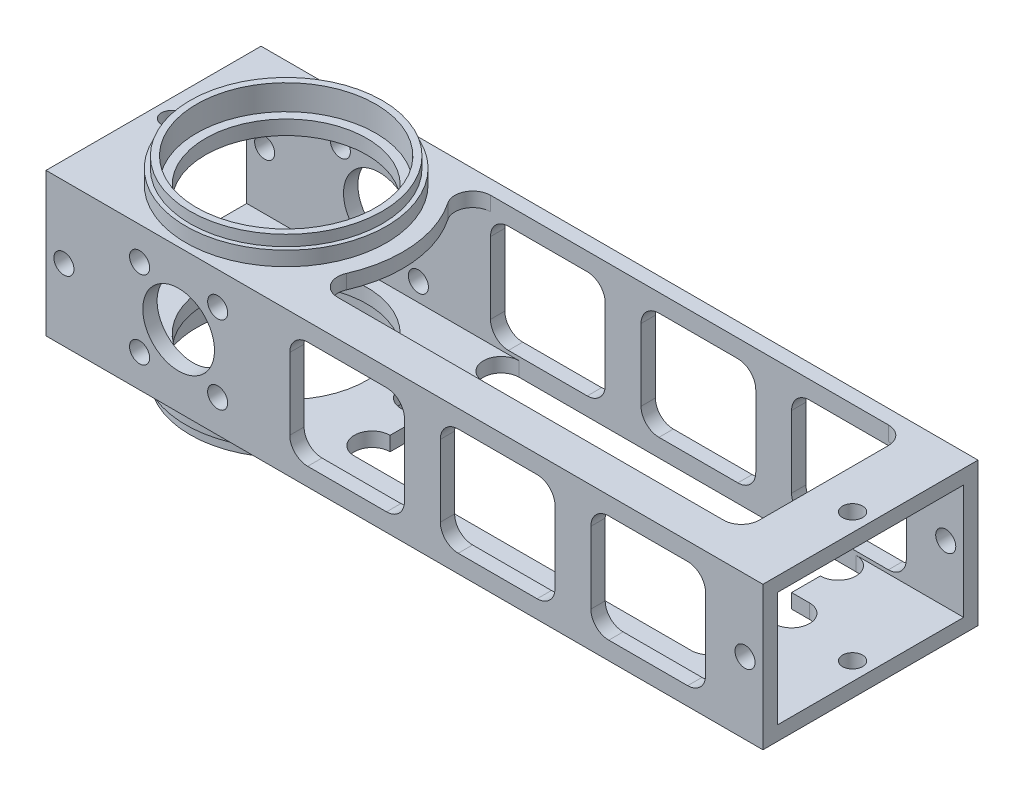
from build123d import *

# Parameters (mm, degrees)
SKETCH1_W                            = 38.1
SKETCH1_H                            = 25.4
SKETCH1_W_2                          = 33.02
SKETCH1_H_2                          = 20.32
BOSS_EXTRUDE1_DEPTH                  = 127
SKETCH2_R                            = 14.2875
CUT_EXTRUDE1_DEPTH                   = 136.002851822
SKETCH3_R                            = 6.35
SKETCH3_R_2                          = 1.778
CUT_EXTRUDE2_DEPTH                   = 136.002851822
CUT_EXTRUDE3_REACH                   = 137.003
F_4_0_209_DIAMETER_HOLE1_D           = 3.556
F_4_0_209_DIAMETER_HOLE1_ON_FACE_2_D = 3.556
F_4_0_209_DIAMETER_HOLE1_ON_FACE_3_D = 3.556
F_4_0_209_DIAMETER_HOLE1_ON_FACE_4_D = 3.556
CUT_EXTRUDE4_REACH                   = 137.003


with BuildPart() as part:
    # Sketch1 → Boss-Extrude1 (new body)
    with BuildSketch(Plane(origin=(0, 0, 0), x_dir=(0, 0, -1), z_dir=(1, 0, 0))):
        with Locations((19.05, 12.7)):
            Rectangle(SKETCH1_W, SKETCH1_H)
        with Locations((19.05, 12.7)):
            Rectangle(SKETCH1_W_2, SKETCH1_H_2, mode=Mode.SUBTRACT)
    extrude(amount=BOSS_EXTRUDE1_DEPTH)

    # Sketch2 → Cut-Extrude1 (cut, through all)
    with BuildSketch(Plane(origin=(0, 25.4, 0), x_dir=(1, 0, 0), z_dir=(0, 1, 0))):
        with Locations((23.495, 19.05)):
            Circle(SKETCH2_R)
    extrude(amount=-CUT_EXTRUDE1_DEPTH, mode=Mode.SUBTRACT)

    # Sketch3 → Cut-Extrude2 (cut, through all)
    with BuildSketch(Plane.XY):
        with Locations((23.495, 12.7)):
            Circle(SKETCH3_R)
        with Locations((16.580202787, 19.614797213)):
            Circle(SKETCH3_R_2)
        with Locations((16.580202787, 5.785202787)):
            Circle(SKETCH3_R_2)
        with Locations((30.409797213, 5.785202787)):
            Circle(SKETCH3_R_2)
        with Locations((30.409797213, 19.614797213)):
            Circle(SKETCH3_R_2)
        with BuildLine():
            Line((46.355, 22.225), (60.325, 22.225))
            ThreePointArc((60.325, 22.225), (62.57006403, 21.29506403), (63.5, 19.05))
            Line((63.5, 19.05), (63.5, 6.35))
            ThreePointArc((63.5, 6.35), (62.57006403, 4.10493597), (60.325, 3.175))
            Line((60.325, 3.175), (46.355, 3.175))
            ThreePointArc((46.355, 3.175), (44.10993597, 4.10493597), (43.18, 6.35))
            Line((43.18, 6.35), (43.18, 19.05))
            ThreePointArc((43.18, 19.05), (44.10993597, 21.29506403), (46.355, 22.225))
        make_face()
        with BuildLine():
            Line((73.025, 22.225), (86.995, 22.225))
            ThreePointArc((86.995, 22.225), (89.24006403, 21.29506403), (90.17, 19.05))
            Line((90.17, 19.05), (90.17, 6.35))
            ThreePointArc((90.17, 6.35), (89.24006403, 4.10493597), (86.995, 3.175))
            Line((86.995, 3.175), (73.025, 3.175))
            ThreePointArc((73.025, 3.175), (70.77993597, 4.10493597), (69.85, 6.35))
            Line((69.85, 6.35), (69.85, 19.05))
            ThreePointArc((69.85, 19.05), (70.77993597, 21.29506403), (73.025, 22.225))
        make_face()
        with BuildLine():
            Line((99.695, 22.225), (113.665, 22.225))
            ThreePointArc((113.665, 22.225), (115.91006403, 21.29506403), (116.84, 19.05))
            Line((116.84, 19.05), (116.84, 6.35))
            ThreePointArc((116.84, 6.35), (115.91006403, 4.10493597), (113.665, 3.175))
            Line((113.665, 3.175), (99.695, 3.175))
            ThreePointArc((99.695, 3.175), (97.44993597, 4.10493597), (96.52, 6.35))
            Line((96.52, 6.35), (96.52, 19.05))
            ThreePointArc((96.52, 19.05), (97.44993597, 21.29506403), (99.695, 22.225))
        make_face()
    extrude(amount=-CUT_EXTRUDE2_DEPTH, mode=Mode.SUBTRACT)

    # Sketch4 → Cut-Extrude3 (cut, up to next)
    with BuildSketch(Plane(origin=(0, 25.4, 0), x_dir=(1, 0, 0), z_dir=(0, 1, 0)), mode=Mode.PRIVATE) as cut_extrude3_sk1:
        with BuildLine():
            Line((45.319516747, 6.35), (113.665, 6.35))
            ThreePointArc((113.665, 6.35), (115.91006403, 7.27993597), (116.84, 9.525))
            Line((116.84, 9.525), (116.84, 32.385))
            ThreePointArc((116.84, 32.385), (115.91006403, 34.63006403), (113.665, 35.56))
            Line((113.665, 35.56), (43.223480206, 35.56))
            ThreePointArc((43.223480206, 35.56), (40.419396131, 33.874207004), (40.593016179, 30.607))
            ThreePointArc((40.593016179, 30.607), (44.046292615, 20.934350844), (42.409581181, 10.795))
            ThreePointArc((42.409581181, 10.795), (42.663121163, 7.78598088), (45.319516747, 6.35))
        make_face()
    cut_extrude3_tool1 = extrude(cut_extrude3_sk1.sketch, amount=-CUT_EXTRUDE3_REACH, mode=Mode.PRIVATE) & part.part
    add(cut_extrude3_tool1.solids().sort_by_distance((79.681448, 25.4, -21.040871))[0], mode=Mode.SUBTRACT)

    # #4 (0.209) Diameter Hole1 (through all)
    with Locations(Plane(origin=(3.175, 25.4, -19.05), x_dir=(0, 0, 1), z_dir=(0, 1, 0))):
        with Locations((0, 0), (0, 120.65)):
            Hole(F_4_0_209_DIAMETER_HOLE1_D / 2)

    # #4 (0.209) Diameter Hole1 on face 2 (through all)
    with Locations(Plane(origin=(123.825, 12.7, 0), x_dir=(1, 0, 0), z_dir=(0, 0, 1))):
        with Locations((0, 0), (-120.65, 0)):
            Hole(F_4_0_209_DIAMETER_HOLE1_ON_FACE_2_D / 2)

    # #4 (0.209) Diameter Hole1 on face 3 (through all)
    with Locations(Plane(origin=(123.825, 0, -19.05), x_dir=(0, 0, -1), z_dir=(0, -1, 0))):
        with Locations((0, 0), (0, -120.65)):
            Hole(F_4_0_209_DIAMETER_HOLE1_ON_FACE_3_D / 2)

    # #4 (0.209) Diameter Hole1 on face 4 (through all)
    with Locations(Plane(origin=(123.825, 12.7, -38.1), x_dir=(-1, 0, 0), z_dir=(0, 0, -1))):
        with Locations((0, 0), (120.65, 0)):
            Hole(F_4_0_209_DIAMETER_HOLE1_ON_FACE_4_D / 2)

    # Sketch6 → Cut-Extrude4 (cut, up to next)
    with BuildSketch(Plane.XZ, mode=Mode.PRIVATE) as cut_extrude4_sk1:
        with BuildLine():
            Line((48.26, -35.56), (107.95, -35.56))
            ThreePointArc((107.95, -35.56), (111.125, -32.385), (107.95, -29.21))
            Line((107.95, -29.21), (107.95, -24.13))
            Line((107.95, -24.13), (111.125, -24.13))
            ThreePointArc((111.125, -24.13), (114.3, -20.955), (111.125, -17.78))
            Line((111.125, -17.78), (107.95, -17.78))
            Line((107.95, -17.78), (107.95, -12.7))
            ThreePointArc((107.95, -12.7), (111.125, -9.525), (107.95, -6.35))
            Line((107.95, -6.35), (48.26, -6.35))
            ThreePointArc((48.26, -6.35), (45.085, -9.525), (48.26, -12.7))
            Line((48.26, -12.7), (48.26, -17.78))
            Line((48.26, -17.78), (45.085, -17.78))
            ThreePointArc((45.085, -17.78), (41.91, -20.955), (45.085, -24.13))
            Line((45.085, -24.13), (48.26, -24.13))
            Line((48.26, -24.13), (48.26, -29.21))
            ThreePointArc((48.26, -29.21), (45.085, -32.385), (48.26, -35.56))
        make_face()
    cut_extrude4_tool1 = extrude(cut_extrude4_sk1.sketch, amount=-CUT_EXTRUDE4_REACH, mode=Mode.PRIVATE) & part.part
    add(cut_extrude4_tool1.solids().sort_by_distance((78.105, 0, -20.955))[0], mode=Mode.SUBTRACT)

    # Sketch7 → Revolve1 (revolve)
    with BuildSketch(Plane.XY.offset(-19.05)):
        Polygon((39.37, 29.845), (39.37, 25.4), (41.275, 25.4), (41.275, 27.94), (40.513, 27.94), (40.513, 29.845), align=None)
        Polygon((39.37, -4.445), (39.37, 0), (41.275, 0), (41.275, -2.54), (40.513, -2.54), (40.513, -4.445), align=None)
    revolve(axis=Axis((23.495, -4.445, -19.05), (0, 1, 0)))


solid = part.part
